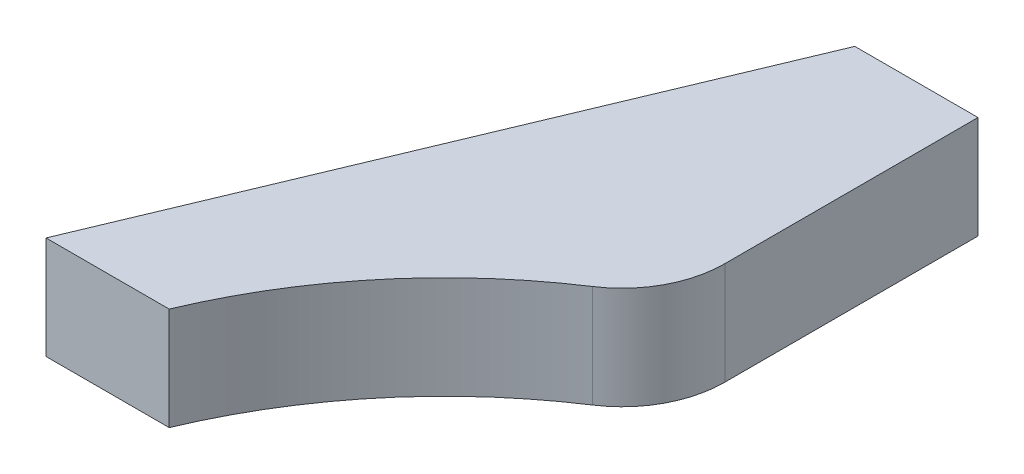
from build123d import *

# Parameters (mm, degrees)
EXTRUDE_2_DEPTH     = 5
SKETCH_4_R          = 1.65
CUT_EXTRUDE_1_DEPTH = 5
EXTRUDE_3_DEPTH     = 5
CUT_EXTRUDE_START   = -4.5
SKETCH_7_R          = 3
CUT_EXTRUDE_2_DEPTH = 3
CUT_EXTRUDE_3_DEPTH = 7.5
EXTRUDE_4_DEPTH     = 5
FILLET_1_R          = 5
FILLET_2_R          = 5
SKETCH_10_R         = 1.65
CUT_EXTRUDE_4_DEPTH = 5


with BuildPart() as part:
    # 草图3 → 凸台-拉伸2 (new body)
    with BuildSketch(Plane(origin=(0, 0, 0), x_dir=(1, 0, 0), z_dir=(0, 1, 0))):
        with BuildLine():
            Line((-3, -3.354101966), (-3, -7.416198487))
            Line((-3, -7.416198487), (-3, -43.854101966))
            Line((-3, -43.854101966), (3, -43.854101966))
            Line((3, -43.854101966), (3, -10.583005244))
            Line((3, -10.583005244), (3, -7.416198487))
            Line((3, -7.416198487), (3, -3.354101966))
            ThreePointArc((3, -3.354101966), (0, 4.5), (-3, -3.354101966))
        make_face()
    extrude(amount=EXTRUDE_2_DEPTH)

    # 草图4 → 切除-拉伸1 (cut)
    with BuildSketch(Plane(origin=(0, 5, 0), x_dir=(1, 0, 0), z_dir=(0, 1, 0))):
        with Locations(Location((0, 0, 0), (0, 0, 270))):
            Circle(SKETCH_4_R)
    extrude(amount=-CUT_EXTRUDE_1_DEPTH, mode=Mode.SUBTRACT)

    # 草图6 → 凸台-拉伸3 (add)
    with BuildSketch(Plane(origin=(0, 5, 0), x_dir=(1, 0, 0), z_dir=(0, 1, 0))):
        with BuildLine():
            Line((3, -33.74604712), (-3, -33.74604712))
            ThreePointArc((-3, -33.74604712), (-16.46902092, -57.986607816), (0.722500961, -79.745993902))
            Line((0.722500961, -79.745993902), (1.949520222, -77.620734201))
            ThreePointArc((1.949520222, -77.620734201), (-10.543317179, -55.371702353), (3, -33.74604712))
        make_face()
    extrude(amount=-EXTRUDE_3_DEPTH)

    # 草图7 → 切除-拉伸2 (cut)
    with BuildSketch(Plane(origin=(0, 5, 0), x_dir=(1, 0, 0), z_dir=(0, 1, 0)).offset(CUT_EXTRUDE_START)):
        with Locations(Location((0, 0, 0), (0, 0, 270))):
            Circle(SKETCH_7_R)
    extrude(amount=-CUT_EXTRUDE_2_DEPTH, mode=Mode.SUBTRACT)

    # 草图8 → 切除-拉伸3 (cut)
    with BuildSketch(Plane(origin=(0, 5, 0), x_dir=(1, 0, 0), z_dir=(0, 1, 0))):
        with BuildLine():
            Line((-3, -38.067187498), (-3, -43.854101966))
            Line((-3, -43.854101966), (3, -43.854101966))
            Line((3, -43.854101966), (3, -33.74604712))
            ThreePointArc((3, -33.74604712), (-0.160637142, -35.683569047), (-3, -38.067187498))
        make_face()
    extrude(amount=-CUT_EXTRUDE_3_DEPTH, mode=Mode.SUBTRACT)

    # 草图9 → 凸台-拉伸4 (add)
    with BuildSketch(Plane(origin=(0, 5, 0), x_dir=(1, 0, 0), z_dir=(0, 1, 0))):
        with BuildLine():
            Line((-3, -18.550074543), (-14.614967684, -46.324924269))
            ThreePointArc((-14.614967684, -46.324924269), (-9.917875534, -39.010182445), (-3, -33.74604712))
            Line((-3, -33.74604712), (-3, -18.550074543))
        make_face()
    extrude(amount=-EXTRUDE_4_DEPTH)

    # 圆角1
    fillet_1_edges = [part.edges().sort_by_distance(p)[0] for p in [
        (3, 2.5, 33.74604712),
    ]]
    fillet(fillet_1_edges, radius=FILLET_1_R)

    # 圆角2
    # the kernel refuses this fillet: 5 mm, written as the material it takes off along each edge
    with BuildSketch(Plane(origin=(1.949520222, 14.371610933, 77.620734201), x_dir=(-0.8261015944022844, 0, -0.5635212114250925), z_dir=(0, -1, 0))) as fillet_2_piece_1:
        with BuildLine():
            CenterArc((4.123508811, -4.985927863), FILLET_2_R, 94.299664485, 55.185648669)
            Line((-0.183986354, -2.447131808), (-0.270136257, -2.396355887))
            ThreePointArc((-0.270136257, -2.396355887), (-0.191711734, -1.216068615), (-0.099718557, 0.007497289))
            Line((-0.099718557, 0.007497289), (0.007497289, 0.099718557))
            ThreePointArc((0.007497289, 0.099718557), (1.874322187, 0.029639314), (3.741147084, 0.099718557))
            Line((3.741147084, 0.099718557), (3.748644373, 0))
        make_face()
    extrude(amount=23.743221866, mode=Mode.SUBTRACT)

    # 草图10 → 切除-拉伸4 (cut)
    # profile 1 of 2: a face of its own
    with BuildSketch(Plane(origin=(0, 5, 0), x_dir=(1, 0, 0), z_dir=(0, 1, 0))):
        with BuildLine():
            Line((-3, -3.354101966), (-3, -18.550074543))
            Line((-3, -18.550074543), (3, -18.550074543))
            Line((3, -18.550074543), (3, -3.354101966))
            ThreePointArc((3, -3.354101966), (0, 4.5), (-3, -3.354101966))
        make_face()
        Circle(SKETCH_10_R, mode=Mode.SUBTRACT)
    # profile 2 of 2: a face of its own
    with BuildSketch(Plane(origin=(0, 5, 0), x_dir=(1, 0, 0), z_dir=(0, 1, 0))):
        with BuildLine():
            Line((-8.614967684, -46.324924269), (-14.614967684, -46.324924269))
            ThreePointArc((-14.614967684, -46.324924269), (-14.272081884, -66.397409294), (0.722500961, -79.745993902))
            ThreePointArc((0.722500961, -79.745993902), (0.307928877, -77.397579493), (-1.147240872, -75.508293582))
            ThreePointArc((-1.147240872, -75.508293582), (-9.770106213, -62.167654699), (-8.614967684, -46.324924269))
        make_face()
    extrude(amount=-CUT_EXTRUDE_4_DEPTH, mode=Mode.SUBTRACT)


solid = part.part
